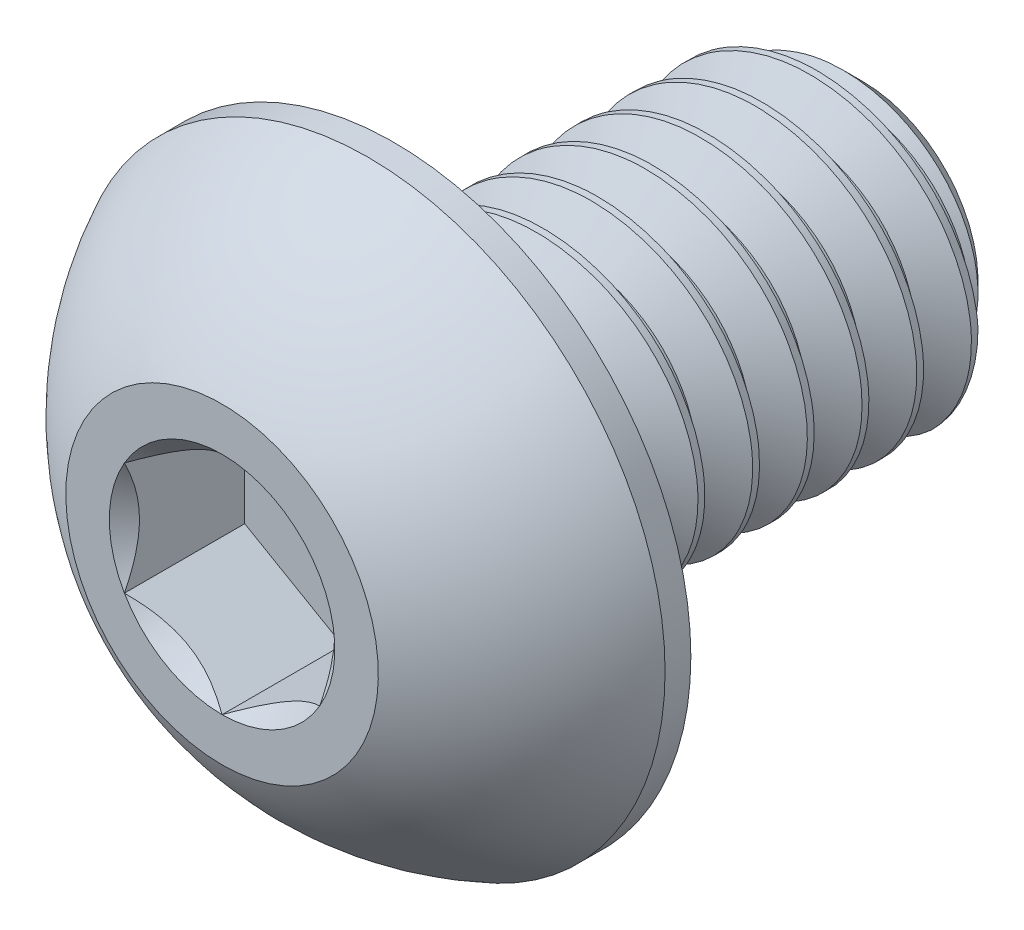
from build123d import *

# Parameters (mm, degrees)
SKETCH1_W          = 6
SKETCH1_H          = 2
CHAMFER1_SIZE      = 0.525
CUT_SWEEP1_PITCH   = 0.7
CUT_EXTRUDE2_DEPTH = 1.54


with BuildPart() as part:
    # Sketch1 → Revolve1 (revolve)
    with BuildSketch(Plane(origin=(0, 0, 0), x_dir=(0, 0, -1), z_dir=(1, 0, 0))):
        with Locations((5.2, 1)):
            Rectangle(SKETCH1_W, SKETCH1_H)
    revolve(axis=Axis((0, 0, -8.2), (0, 0, 1)))

    # Chamfer1
    chamfer1_edges = [part.edges().sort_by_distance(p)[0] for p in [
        (0, -2, -8.2),
    ]]
    chamfer(chamfer1_edges, length=CHAMFER1_SIZE)

    # Cut-Sweep1: the profile of Sketch2 profile screwed along a right-hand helix of 9.571429 turns, 6 arcs to a turn; built about Z, then put on its axis
    cut_sweep1_z = Axis((0, 0, 0), (0, 0, 1))
    cut_sweep1_corners = [(2.0003, 0, 0.000173205), (2.0003, 0, -0.612673205), (1.545336663, 0, -0.35), (1.545336663, 0, -0.2625)]
    with BuildLine(mode=Mode.PRIVATE) as cut_sweep1_profile:
        Line(cut_sweep1_corners[0], cut_sweep1_corners[1])
        Line(cut_sweep1_corners[1], cut_sweep1_corners[2])
        Line(cut_sweep1_corners[2], cut_sweep1_corners[3])
        Line(cut_sweep1_corners[3], cut_sweep1_corners[0])
    cut_sweep1_cap = Face(cut_sweep1_profile.wire())
    cut_sweep1_turn_angles = [0, 30, 60, 90, 120, 150, 180, 210, 240, 270, 300, 330, 360]
    cut_sweep1_turn_weights = [1, 0.8660254037844387, 1, 0.8660254037844387, 1, 0.8660254037844387, 1, 0.8660254037844387, 1, 0.8660254037844387, 1, 0.8660254037844387, 1]
    cut_sweep1_turn_rails = [Edge.make_bspline([Vector(p[0], p[1], 0).rotate(cut_sweep1_z, cut_sweep1_turn_angles[k]) / cut_sweep1_turn_weights[k] + Vector(0, 0, p[2] + CUT_SWEEP1_PITCH * cut_sweep1_turn_angles[k] / 360) for k in range(13)], [0, 0, 0, 1, 1, 2, 2, 3, 3, 4, 4, 5, 5, 6, 6, 6], 2, cut_sweep1_turn_weights) for p in cut_sweep1_corners]
    cut_sweep1_turn_sides = [Face.make_surface_from_curves(cut_sweep1_turn_rails[p[0]], cut_sweep1_turn_rails[p[1]]) for p in [(0, 1), (1, 2), (2, 3), (3, 0)]]
    cut_sweep1_last_angles = [3240, 3270, 3300, 3330, 3360, 3390, 3420, 3432.857142857, 3445.714285714]
    cut_sweep1_last_weights = [1, 0.8660254037844387, 1, 0.8660254037844387, 1, 0.8660254037844387, 1, 0.9749279121818508, 1]
    cut_sweep1_last_rails = [Edge.make_bspline([Vector(p[0], p[1], 0).rotate(cut_sweep1_z, cut_sweep1_last_angles[k]) / cut_sweep1_last_weights[k] + Vector(0, 0, p[2] + CUT_SWEEP1_PITCH * cut_sweep1_last_angles[k] / 360) for k in range(9)], [0, 0, 0, 1, 1, 2, 2, 3, 3, 4, 4, 4], 2, cut_sweep1_last_weights) for p in cut_sweep1_corners]
    cut_sweep1_last_sides = [Face.make_surface_from_curves(cut_sweep1_last_rails[p[0]], cut_sweep1_last_rails[p[1]]) for p in [(0, 1), (1, 2), (2, 3), (3, 0)]]
    cut_sweep1 = Plane(origin=(0, 0, -8.2), x_dir=(0, 1, 0), z_dir=(0, 0, 1)) * Solid(Shell([*[p.moved(Location((0, 0, CUT_SWEEP1_PITCH * i))) for i in range(9) for p in cut_sweep1_turn_sides], *cut_sweep1_last_sides, cut_sweep1_cap, cut_sweep1_cap.rotate(cut_sweep1_z, 3445.714285714).moved(Location((0, 0, CUT_SWEEP1_PITCH * 3445.714285714 / 360)))]))
    add(cut_sweep1, mode=Mode.SUBTRACT)

    # Sketch7 → Revolve2 (revolve)
    with BuildSketch(Plane(origin=(0, 0, 0), x_dir=(0, 0, -1), z_dir=(1, 0, 0)), mode=Mode.PRIVATE) as revolve2_sk:
        with BuildLine():
            Line((1.87, 3.8), (2.2, 3.8))
            Line((2.2, 3.8), (2.2, 0))
            Line((2.2, 0), (0, 0))
            Line((0, 0), (0, 2))
            ThreePointArc((0, 2), (0.793500147, 3.047002626), (1.87, 3.8))
        make_face()
    revolve(revolve2_sk.sketch.rotate(Axis((0, 0, 0), (0, 0, -1)), 189.336081704), axis=Axis((0, 0, 0), (0, 0, -1)))

    # Sketch5 → Cut-Extrude2 (cut)
    with BuildSketch(Plane.XY):
        Polygon((1.25, -0.721687836), (1.25, 0.721687836), (0, 1.443375673), (-1.25, 0.721687836), (-1.25, -0.721687836), (0, -1.443375673), align=None)
    extrude(amount=-CUT_EXTRUDE2_DEPTH, mode=Mode.SUBTRACT)

    # Cut-Extrude3 cone 1 section (through the dimple's axis) → Cut-Extrude3 (revolve, cut)
    with BuildSketch(Plane(origin=(0, 0, 0), x_dir=(0, -1, 0), z_dir=(1, 0, 0))):
        Polygon((0, 0), (1.443375673, 0), (0, 1.443375673), align=None)
    revolve(axis=Axis((0, 0, 0), (0, 0, -1)), mode=Mode.SUBTRACT)


solid = part.part
